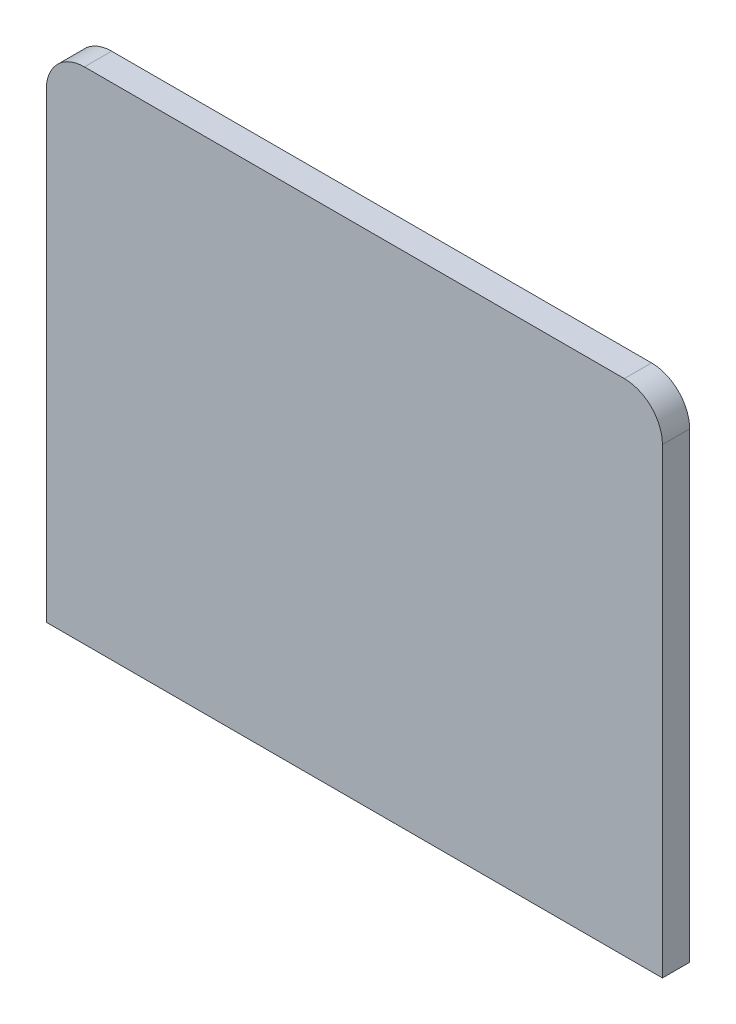
from build123d import *

# Parameters (mm, degrees)
FLANGE_BASE1_DEPTH = 9.53


# Sheet-metal steps are written as plain solids
with BuildPart() as part:
    # Esboço1 → Flange-base1 (new body)
    with BuildSketch(Plane.XY):
        with BuildLine():
            Line((-107.95, 0), (107.95, 0))
            Line((107.95, 0), (107.95, 161.89))
            ThreePointArc((107.95, 161.89), (104.039875529, 171.329875529), (94.6, 175.24))
            Line((94.6, 175.24), (-94.6, 175.24))
            ThreePointArc((-94.6, 175.24), (-104.039875529, 171.329875529), (-107.95, 161.89))
            Line((-107.95, 161.89), (-107.95, 0))
        make_face()
    extrude(amount=-FLANGE_BASE1_DEPTH)


solid = part.part
